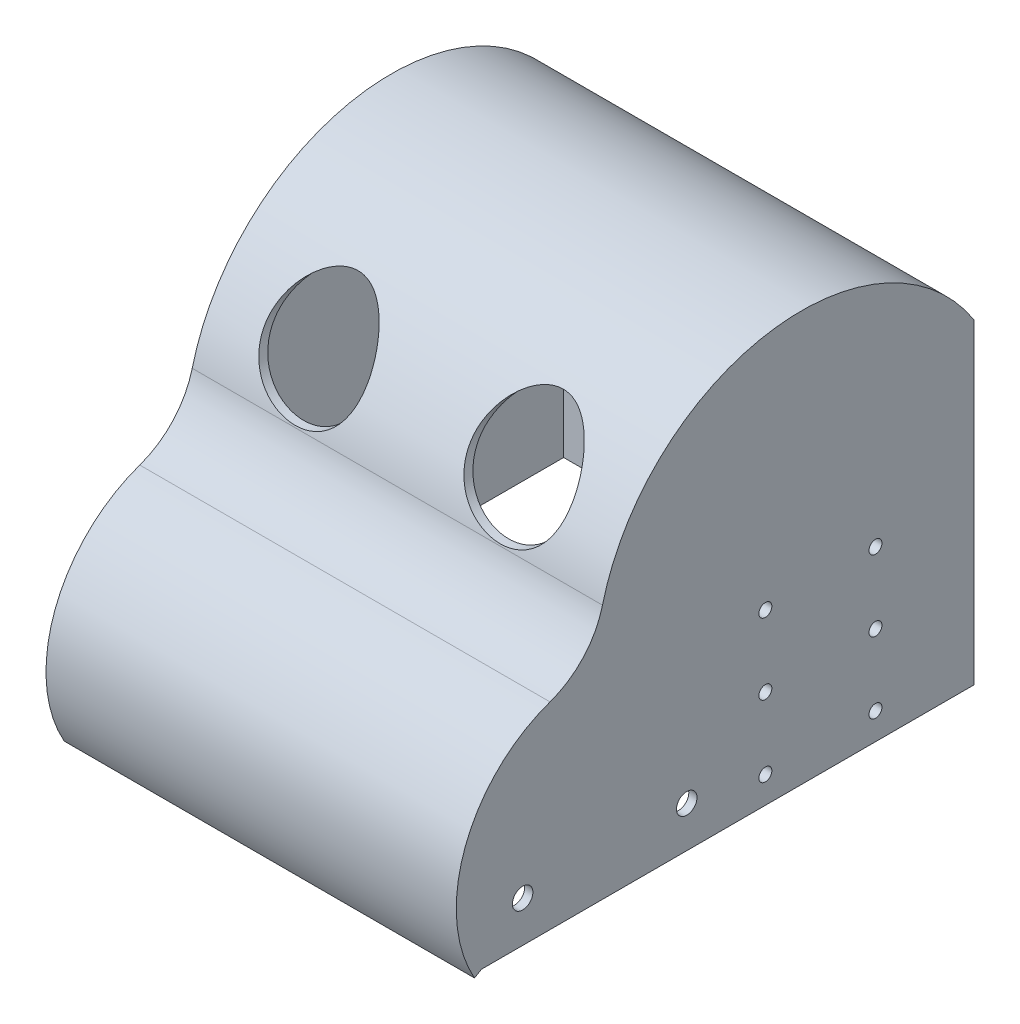
from build123d import *

# Parameters (mm, degrees)
BOSS_EXTRUDE1_DEPTH = 127
SHELL1_START        = 2.54
SHELL1_DEPTH        = 121.92
CUT_EXTRUDE5_DEPTH  = 236.549909786
SKETCH20_R          = 3.175
CUT_EXTRUDE7_DEPTH  = 236.549909786
FILLET1_R           = 25.4
SKETCH21_R          = 15.875
SKETCH21_R_2        = 9.525
BOSS_EXTRUDE2_DEPTH = 12.7
SKETCH22_R          = 27.5
SKETCH22_R_2        = 14.2875
BOSS_EXTRUDE4_DEPTH = 1.5875
SKETCH23_R          = 2.5
CUT_EXTRUDE8_DEPTH  = 3.175
SKETCH24_R          = 8.89
CUT_EXTRUDE9_DEPTH  = 12.7
SKETCH25_R          = 15.875
CUT_EXTRUDE10_DEPTH = 63.5
SKETCH26_W          = 7.62
SKETCH26_H          = 35.56
SKETCH26_H_2        = 2.54
BOSS_EXTRUDE5_DEPTH = 31.75
CHAMFER1_SIZE       = 38.1
CHAMFER1_SIZE_2     = 31.969695948
FILLET2_R           = 19.05
SKETCH27_R          = 4.826
CUT_EXTRUDE11_DEPTH = 63.5
SKETCH28_W          = 5
SKETCH28_H          = 60
BOSS_EXTRUDE6_DEPTH = 5
CUT_EXTRUDE13_REACH = 247.036
SKETCH29_R          = 2
SKETCH30_W          = 31.127388046
SKETCH30_H          = 24.370388593
CUT_EXTRUDE14_DEPTH = 12.7
SKETCH31_W          = 38.1
SKETCH31_H          = 2.54
CUT_EXTRUDE15_DEPTH = 30.48


# Read off the part's stored shape, not the designer's step: Shell1
# Some blends are built 0.0001 mm under size
with BuildPart() as part:
    # Sketch3 → Boss-Extrude1 (new body)
    with BuildSketch(Plane(origin=(0, 0, 0), x_dir=(0, 0, -1), z_dir=(1, 0, 0))):
        with BuildLine():
            Line((0, 0), (152.4, 0))
            Line((152.4, 0), (152.4, 97.902234225))
            ThreePointArc((152.4, 97.902234225), (81.095616097, 124.415805368), (35.526445872, 63.5))
            ThreePointArc((35.526445872, 63.5), (-1.951598781, 41.957537243), (-2.199704526, -1.27))
            Line((-2.199704526, -1.27), (0, 0))
        make_face()
    extrude(amount=BOSS_EXTRUDE1_DEPTH)

    # Shell1 outline → Shell1 (cut)
    with BuildSketch(Plane.YZ.offset(SHELL1_START)):
        with BuildLine():
            Line((0, -149.86), (97.146268362, -149.86))
            ThreePointArc((97.146268362, -149.86), (121.481997306, -80.205989224), (60.877364675, -38.122887815))
            ThreePointArc((60.877364675, -38.122887815), (41.799316368, -0.919969929), (0, -9.0799e-05))
            Line((0, -9.0799e-05), (0, -149.86))
        make_face()
    extrude(amount=SHELL1_DEPTH, mode=Mode.SUBTRACT)

    # Sketch19 → Cut-Extrude5 (cut, through all)
    with BuildSketch(Plane(origin=(127, 0, 0), x_dir=(0, 0, -1), z_dir=(1, 0, 0))):
        with BuildLine():
            ThreePointArc((9.525, 12.7), (10.45493597, 10.45493597), (12.7, 9.525))
            Line((12.7, 9.525), (12.7, 12.7))
            Line((12.7, 12.7), (9.525, 12.7))
        make_face()
        with BuildLine():
            Line((12.7, 12.7), (12.7, 9.525))
            ThreePointArc((12.7, 9.525), (14.94506403, 10.45493597), (15.875, 12.7))
            ThreePointArc((15.875, 12.7), (12.7, 15.875), (9.525, 12.7))
            Line((9.525, 12.7), (12.7, 12.7))
        make_face()
    extrude(amount=-CUT_EXTRUDE5_DEPTH, mode=Mode.SUBTRACT)

    # Sketch20 → Cut-Extrude7 (cut, through all)
    with BuildSketch(Plane(origin=(127, 0, 0), x_dir=(0, 0, -1), z_dir=(1, 0, 0))):
        with Locations((63.5, 12.7)):
            Circle(SKETCH20_R)
    extrude(amount=-CUT_EXTRUDE7_DEPTH, mode=Mode.SUBTRACT)

    # Fillet1
    fillet1_edges = [part.edges().sort_by_distance(p)[0] for p in [
        (63.5, 63.5, -35.526445872),
    ]]
    fillet(fillet1_edges, radius=FILLET1_R)

    # Sketch21 → Boss-Extrude2 (add)
    with BuildSketch(Plane(origin=(0, 0, -152.4), x_dir=(-1, 0, 0), z_dir=(0, 0, -1))):
        with Locations(Location((-63.5, 57.384086824, 0), (0, 0, 270))):
            Circle(SKETCH21_R)
        with Locations(Location((-63.5, 57.384086824, 0), (0, 0, 90))):
            Circle(SKETCH21_R_2, mode=Mode.SUBTRACT)
    extrude(amount=BOSS_EXTRUDE2_DEPTH)

    # Sketch22 → Boss-Extrude4 (add, symmetric)
    with BuildSketch(Plane(origin=(0, 0, -165.1), x_dir=(-1, 0, 0), z_dir=(0, 0, -1))):
        with Locations(Location((-63.5, 57.384086824, 0), (0, 0, 90))):
            Circle(SKETCH22_R)
        with Locations(Location((-63.5, 57.384086824, 0), (0, 0, 90))):
            Circle(SKETCH22_R_2, mode=Mode.SUBTRACT)
    extrude(amount=BOSS_EXTRUDE4_DEPTH, both=True)

    # Sketch23 → Cut-Extrude8 (cut)
    with BuildSketch(Plane(origin=(0, 0, -166.6875), x_dir=(-1, 0, 0), z_dir=(0, 0, -1))):
        with Locations(Location((-63.5, 79.884086824, 0), (0, 0, 90))):
            Circle(SKETCH23_R)
        with Locations(Location((-41, 57.384086824, 0), (0, 0, 90))):
            Circle(SKETCH23_R)
        with Locations(Location((-63.5, 34.884086824, 0), (0, 0, 90))):
            Circle(SKETCH23_R)
        with Locations(Location((-86, 57.384086824, 0), (0, 0, 90))):
            Circle(SKETCH23_R)
    extrude(amount=-CUT_EXTRUDE8_DEPTH, mode=Mode.SUBTRACT)

    # Sketch24 → Cut-Extrude9 (cut)
    with BuildSketch(Plane(origin=(0, 0, -152.4), x_dir=(-1, 0, 0), z_dir=(0, 0, -1))):
        with Locations(Location((-63.5, 85.324086824, 0), (0, 0, 90))):
            Circle(SKETCH24_R)
    extrude(amount=-CUT_EXTRUDE9_DEPTH, mode=Mode.SUBTRACT)

    # Sketch25 → Cut-Extrude10 (cut)
    with BuildSketch(Plane.XY):
        with Locations((31.75, 95.25)):
            Circle(SKETCH25_R)
        with Locations((95.25, 95.25)):
            Circle(SKETCH25_R)
    extrude(amount=-CUT_EXTRUDE10_DEPTH, mode=Mode.SUBTRACT)

    # Sketch26 → Boss-Extrude5 (add, symmetric)
    with BuildSketch(Plane.XZ):
        with Locations((40.64, -132.08)):
            Rectangle(SKETCH26_W, SKETCH26_H)
        with Locations((86.36, -132.08)):
            Rectangle(SKETCH26_W, SKETCH26_H)
        with Locations((86.36, -151.13)):
            Rectangle(SKETCH26_W, SKETCH26_H_2)
        with Locations((40.64, -151.13)):
            Rectangle(SKETCH26_W, SKETCH26_H_2)
    extrude(amount=BOSS_EXTRUDE5_DEPTH, both=True)

    # Chamfer1
    # the kernel refuses this chamfer: 38.1, 31.969695948 mm, written as the material it takes off along each edge
    with BuildSketch(Plane(origin=(90.17, 31.75, -114.3), x_dir=(0, 0.024939322090234358, -0.9996889667359941), z_dir=(-1, 0, 0))) as chamfer1_piece_1_section:
        Polygon((CHAMFER1_SIZE * 0.999688966736, CHAMFER1_SIZE * 0.0249393220902), (-CHAMFER1_SIZE_2 * 0.0249393220901, CHAMFER1_SIZE_2 * 0.999688966731), (0, 0), align=None)
    chamfer1_piece_1 = extrude(amount=105.819172537, mode=Mode.PRIVATE)
    chamfer1_piece_1 = split(chamfer1_piece_1, bisect_by=Plane(origin=(86.36, 21.050034317, -149.86), z_dir=(0, 0, 1)), keep=Keep.TOP, mode=Mode.PRIVATE)
    chamfer1_piece_1 = split(chamfer1_piece_1, bisect_by=Plane(origin=(2.54, 21.050034317, -126.894759963), z_dir=(1, 0, 0)), keep=Keep.TOP, mode=Mode.PRIVATE)
    add(chamfer1_piece_1, mode=Mode.SUBTRACT)
    with BuildSketch(Plane(origin=(142.649172537, 31.75, -114.3), x_dir=(0, -0.9993728857116146, 0.03540953691366268), z_dir=(-1, 0, 0))) as chamfer1_piece_2_section:
        Polygon((CHAMFER1_SIZE_2 * 0.999372885707, -CHAMFER1_SIZE_2 * 0.0354095369135), (-CHAMFER1_SIZE * 0.0354095369137, -CHAMFER1_SIZE * 0.999372885712), (0, 0), align=None)
    chamfer1_piece_2 = extrude(amount=204.018345075, mode=Mode.PRIVATE)
    chamfer1_piece_2 = split(chamfer1_piece_2, bisect_by=Plane(origin=(86.36, -0.073231983, -149.86), z_dir=(0, 0, 1)), keep=Keep.TOP, mode=Mode.PRIVATE)
    chamfer1_piece_2 = split(chamfer1_piece_2, bisect_by=Plane(origin=(2.54, -0.073231983, -114.387274478), z_dir=(1, 0, 0)), keep=Keep.TOP, mode=Mode.PRIVATE)
    chamfer1_piece_2 = split(chamfer1_piece_2, bisect_by=Plane(origin=(90.17, -0.073231983, -114.387274478), z_dir=(-1, 0, 0)), keep=Keep.TOP, mode=Mode.PRIVATE)
    add(chamfer1_piece_2, mode=Mode.SUBTRACT)

    # Fillet2
    fillet2_edges = [part.edges().sort_by_distance(p)[0] for p in [
        (86.36, -31.75, -114.3),
        (86.36, -31.75, -152.4),
        (40.64, -31.75, -114.3),
        (40.64, -31.75, -152.4),
    ]]
    fillet(fillet2_edges, radius=FILLET2_R - 0.0001)  # a hair under: the kernel refuses the full size

    # Sketch27 → Cut-Extrude11 (cut)
    with BuildSketch(Plane.ZY.offset(-36.83)):
        with Locations((-133.35, -12.7)):
            Circle(SKETCH27_R)
    extrude(amount=-CUT_EXTRUDE11_DEPTH, mode=Mode.SUBTRACT)

    # Sketch28 → Boss-Extrude6 (add)
    with BuildSketch(Plane.ZY.offset(-124.46)):
        with Locations((-121.96, 30)):
            Rectangle(SKETCH28_W, SKETCH28_H)
        with Locations((-87.844, 30)):
            Rectangle(SKETCH28_W, SKETCH28_H)
    extrude(amount=BOSS_EXTRUDE6_DEPTH)

    # Sketch29 → Cut-Extrude13 (cut, up to next)
    with BuildSketch(Plane(origin=(127, 0, 0), x_dir=(0, 0, -1), z_dir=(1, 0, 0)), mode=Mode.PRIVATE) as cut_extrude13_sk1:
        with Locations((87.844, 52.379999946)):
            Circle(SKETCH29_R)
    cut_extrude13_tool1 = extrude(cut_extrude13_sk1.sketch, amount=-CUT_EXTRUDE13_REACH, mode=Mode.PRIVATE) & part.part
    # Sketch29 → Cut-Extrude13 (cut, up to next)
    with BuildSketch(Plane(origin=(127, 0, 0), x_dir=(0, 0, -1), z_dir=(1, 0, 0)), mode=Mode.PRIVATE) as cut_extrude13_sk2:
        with Locations((87.844, 30.379999946)):
            Circle(SKETCH29_R)
    cut_extrude13_tool2 = extrude(cut_extrude13_sk2.sketch, amount=-CUT_EXTRUDE13_REACH, mode=Mode.PRIVATE) & part.part
    # Sketch29 → Cut-Extrude13 (cut, up to next)
    with BuildSketch(Plane(origin=(127, 0, 0), x_dir=(0, 0, -1), z_dir=(1, 0, 0)), mode=Mode.PRIVATE) as cut_extrude13_sk3:
        with Locations((87.844, 8.281999946)):
            Circle(SKETCH29_R)
    cut_extrude13_tool3 = extrude(cut_extrude13_sk3.sketch, amount=-CUT_EXTRUDE13_REACH, mode=Mode.PRIVATE) & part.part
    # Sketch29 → Cut-Extrude13 (cut, up to next)
    with BuildSketch(Plane(origin=(127, 0, 0), x_dir=(0, 0, -1), z_dir=(1, 0, 0)), mode=Mode.PRIVATE) as cut_extrude13_sk4:
        with Locations((121.92, 52.281999946)):
            Circle(SKETCH29_R)
    cut_extrude13_tool4 = extrude(cut_extrude13_sk4.sketch, amount=-CUT_EXTRUDE13_REACH, mode=Mode.PRIVATE) & part.part
    # Sketch29 → Cut-Extrude13 (cut, up to next)
    with BuildSketch(Plane(origin=(127, 0, 0), x_dir=(0, 0, -1), z_dir=(1, 0, 0)), mode=Mode.PRIVATE) as cut_extrude13_sk5:
        with Locations((121.92, 8.281999946)):
            Circle(SKETCH29_R)
    cut_extrude13_tool5 = extrude(cut_extrude13_sk5.sketch, amount=-CUT_EXTRUDE13_REACH, mode=Mode.PRIVATE) & part.part
    # Sketch29 → Cut-Extrude13 (cut, up to next)
    with BuildSketch(Plane(origin=(127, 0, 0), x_dir=(0, 0, -1), z_dir=(1, 0, 0)), mode=Mode.PRIVATE) as cut_extrude13_sk6:
        with Locations((121.92, 30.281999946)):
            Circle(SKETCH29_R)
    cut_extrude13_tool6 = extrude(cut_extrude13_sk6.sketch, amount=-CUT_EXTRUDE13_REACH, mode=Mode.PRIVATE) & part.part
    add(cut_extrude13_tool1.solids().sort_by_distance((127, 52.38, -87.844))[0], mode=Mode.SUBTRACT)
    add(cut_extrude13_tool2.solids().sort_by_distance((127, 30.38, -87.844))[0], mode=Mode.SUBTRACT)
    add(cut_extrude13_tool3.solids().sort_by_distance((127, 8.282, -87.844))[0], mode=Mode.SUBTRACT)
    add(cut_extrude13_tool4.solids().sort_by_distance((127, 52.282, -121.92))[0], mode=Mode.SUBTRACT)
    add(cut_extrude13_tool5.solids().sort_by_distance((127, 8.282, -121.92))[0], mode=Mode.SUBTRACT)
    add(cut_extrude13_tool6.solids().sort_by_distance((127, 30.282, -121.92))[0], mode=Mode.SUBTRACT)

    # Sketch30 → Cut-Extrude14 (cut)
    with BuildSketch(Plane.ZY.offset(-82.55)):
        with Locations((-115.246305977, 11.965498349)):
            Rectangle(SKETCH30_W, SKETCH30_H)
    extrude(amount=-CUT_EXTRUDE14_DEPTH, mode=Mode.SUBTRACT)

    # Sketch31 → Cut-Extrude15 (cut)
    with BuildSketch(Plane.XZ):
        with Locations((63.5, -151.13)):
            Rectangle(SKETCH31_W, SKETCH31_H)
    extrude(amount=-CUT_EXTRUDE15_DEPTH, mode=Mode.SUBTRACT)


solid = part.part
